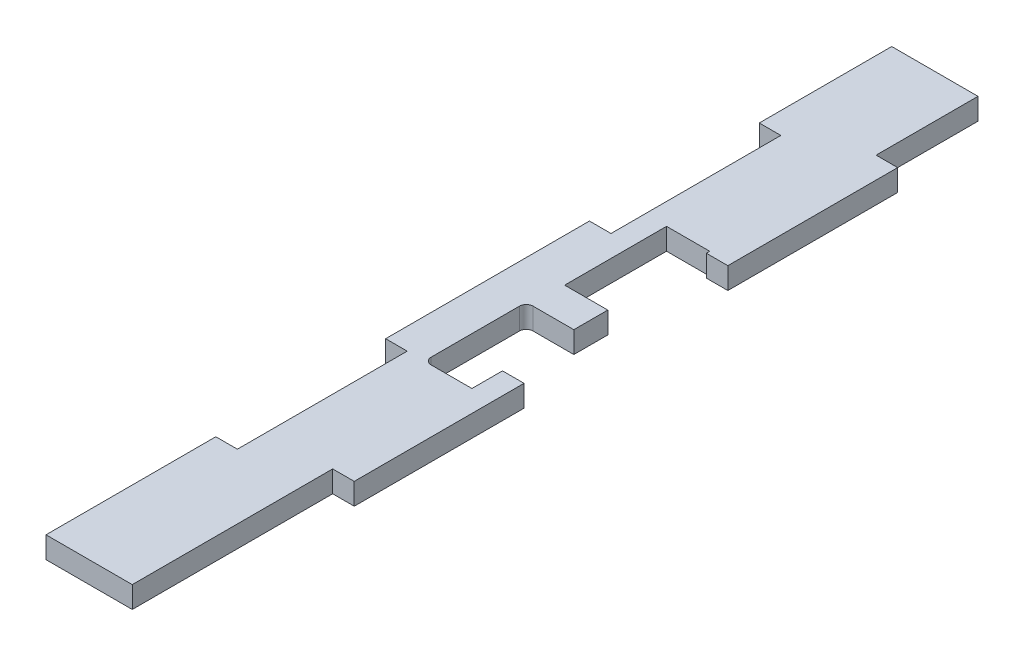
from build123d import *

# Parameters (mm, degrees)
BOSS_EXTRUDE1_DEPTH = 6.35
SKETCH3_W           = 14
SKETCH3_H           = 30
SKETCH3_W_2         = 12.7
CUT_EXTRUDE1_DEPTH  = 252.096365963
FILLET1_R           = 2
SKETCH4_W           = 6.35
SKETCH4_H           = 50
CUT_EXTRUDE2_DEPTH  = 252.096365963


with BuildPart() as part:
    # Sketch2 → Boss-Extrude1 (new body)
    with BuildSketch(Plane(origin=(0, 0, 0), x_dir=(1, 0, 0), z_dir=(0, 1, 0))):
        Polygon((0, 0), (25.4, 0), (25.4, 59), (31.75, 59), (31.75, 109), (25.4, 109), (25.4, 169), (31.75, 169), (31.75, 219), (25.4, 219), (25.4, 249), (0, 249), align=None)
    extrude(amount=BOSS_EXTRUDE1_DEPTH)

    # Sketch3 → Cut-Extrude1 (cut, through all)
    with BuildSketch(Plane(origin=(0, 6.35, 0), x_dir=(1, 0, 0), z_dir=(0, 1, 0))):
        with Locations((18.4, 115)):
            Rectangle(SKETCH3_W, SKETCH3_H)
        with Locations((19.05, 155)):
            Rectangle(SKETCH3_W_2, SKETCH3_H)
    extrude(amount=-CUT_EXTRUDE1_DEPTH, mode=Mode.SUBTRACT)

    # Fillet1
    fillet1_edges = [part.edges().sort_by_distance(p)[0] for p in [
        (11.4, 3.175, -100),
        (11.4, 3.175, -130),
    ]]
    fillet(fillet1_edges, radius=FILLET1_R)

    # Sketch4 → Cut-Extrude2 (cut, through all)
    with BuildSketch(Plane(origin=(0, 6.35, 0), x_dir=(1, 0, 0), z_dir=(0, 1, 0))):
        with Locations((3.175, 75)):
            Rectangle(SKETCH4_W, SKETCH4_H)
        with Locations((3.175, 185)):
            Rectangle(SKETCH4_W, SKETCH4_H)
    extrude(amount=-CUT_EXTRUDE2_DEPTH, mode=Mode.SUBTRACT)


solid = part.part
